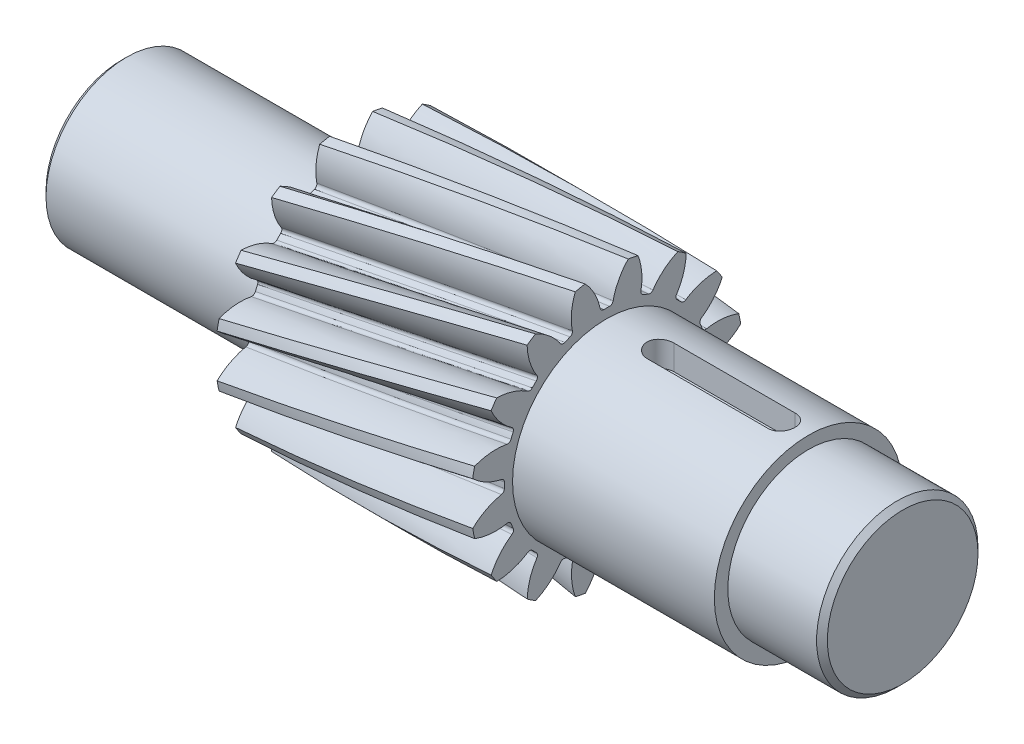
from build123d import *

# Parameters (mm, degrees)
BASPROSKE_W             = 95
BASPROSKE_H             = 50.443365035
TOOTHCUTLH_PITCH        = 1522.43910023
TOOTHCUTLH_HEIGHT       = 95
TOOTHCUTLH_RADIUS       = 50.443365035
TOOTHCUTLH_START_ANGLE  = -90
TEETHCUTSLH_COUNT       = 16
TEETHCUTSLH_ANGLE       = 337.5
BORSKE_R                = 0.4
BORE_DEPTH              = 118.7500025
CROQUIS1_R              = 35
SALIENTE_EXTRUIR1_DEPTH = 75
CROQUIS2_R              = 30
SALIENTE_EXTRUIR2_DEPTH = 35
CROQUIS3_R              = 30
SALIENTE_EXTRUIR3_DEPTH = 85
CHAFL_N1_SIZE           = 2
CORTAR_EXTRUIR1_DEPTH   = 10


with BuildPart() as part:
    # BasProSke → Base-Revolve (revolve)
    with BuildSketch(Plane(origin=(0, 0, 0), x_dir=(1, 0, 0), z_dir=(0, 1, 0)), mode=Mode.PRIVATE) as base_revolve_sk:
        with Locations((47.5, 25.221682518)):
            Rectangle(BASPROSKE_W, BASPROSKE_H)
    revolve(base_revolve_sk.sketch.rotate(Axis((-10, 0, 0), (1, 0, 0)), 180), axis=Axis((-10, 0, 0), (1, 0, 0)))

    # ToothCutLH: sweep along a helix
    with BuildLine() as toothcutlh_path:
        add(Helix(TOOTHCUTLH_PITCH, TOOTHCUTLH_HEIGHT, TOOTHCUTLH_RADIUS, center=(0, 0, 0), direction=(1, 0, 0), lefthand=True, mode=Mode.PRIVATE).rotate(Axis((0, 0, 0), (1, 0, 0)), TOOTHCUTLH_START_ANGLE))
    # TooCutSkeRH<3> → ToothCutLH (sweep, cut)
    with BuildSketch(Plane(origin=(0, 0, 0), x_dir=(0, 0, -1), z_dir=(1, 0, 0))):
        with BuildLine():
            ThreePointArc((1.035340585, 38.054283416), (0, 38.068365035), (-1.035340585, 38.054283416))
            ThreePointArc((-1.035340585, 38.054283416), (-1.926032694, 38.350280261), (-2.419717247, 39.148542203))
            ThreePointArc((-2.419717247, 39.148542203), (-4.922911354, 45.686932697), (-9.353589784, 51.10778315))
            ThreePointArc((-9.353589784, 51.10778315), (0, 51.956665986), (9.353589784, 51.10778315))
            ThreePointArc((9.353589784, 51.10778315), (4.922911354, 45.686932697), (2.419717247, 39.148542203))
            ThreePointArc((2.419717247, 39.148542203), (1.926032694, 38.350280261), (1.035340585, 38.054283416))
        make_face()
    toothcutlh = sweep(path=toothcutlh_path.line, is_frenet=True, mode=Mode.SUBTRACT)

    # TeethCutsLH: ToothCutLH ×16 about axis
    teethcutslh_axis = Axis((-10, 0, 0), (1, 0, 0))
    for i in range(1, TEETHCUTSLH_COUNT):
        add(toothcutlh.rotate(teethcutslh_axis, i * TEETHCUTSLH_ANGLE / (TEETHCUTSLH_COUNT - 1)), mode=Mode.SUBTRACT)

    # BorSke → Bore (cut, symmetric)
    with BuildSketch(Plane(origin=(0, 0, 0), x_dir=(0, 0, -1), z_dir=(1, 0, 0))):
        with Locations(Location((0, 0, 0), (0, 0, 180))):
            Circle(BORSKE_R)
    extrude(amount=BORE_DEPTH, both=True, mode=Mode.SUBTRACT)

    # Croquis1 → Saliente-Extruir1 (add)
    with BuildSketch(Plane(origin=(95, 0, 0), x_dir=(0, 0, -1), z_dir=(1, 0, 0))):
        with Locations(Location((0, -0.4, 0), (0, 0, 180))):
            Circle(CROQUIS1_R)
    extrude(amount=SALIENTE_EXTRUIR1_DEPTH)

    # Croquis2 → Saliente-Extruir2 (add)
    with BuildSketch(Plane(origin=(170, 0, 0), x_dir=(0, 0, -1), z_dir=(1, 0, 0))):
        Circle(CROQUIS2_R)
    extrude(amount=SALIENTE_EXTRUIR2_DEPTH)

    # Croquis3 → Saliente-Extruir3 (add)
    with BuildSketch(Plane.ZY):
        with Locations(Location((0.4, 0, 0), (0, 0, 180))):
            Circle(CROQUIS3_R)
    extrude(amount=SALIENTE_EXTRUIR3_DEPTH)

    # Chaflán1
    chafl_n1_edges = [part.edges().sort_by_distance(p)[0] for p in [
        (205, 0, 30),
        (-85, 0, 30.4),
    ]]
    chamfer(chafl_n1_edges, length=CHAFL_N1_SIZE)

    # Croquis4 → Cortar-Extruir1 (cut)
    with BuildSketch(Plane(origin=(0, 35, 0), x_dir=(1, 0, 0), z_dir=(0, 1, 0))):
        with BuildLine():
            Line((160, -5), (115, -5))
            ThreePointArc((115, -5), (110, 0), (115, 5))
            Line((115, 5), (160, 5))
            ThreePointArc((160, 5), (165, 0), (160, -5))
        make_face()
    extrude(amount=-CORTAR_EXTRUIR1_DEPTH, mode=Mode.SUBTRACT)


solid = part.part
